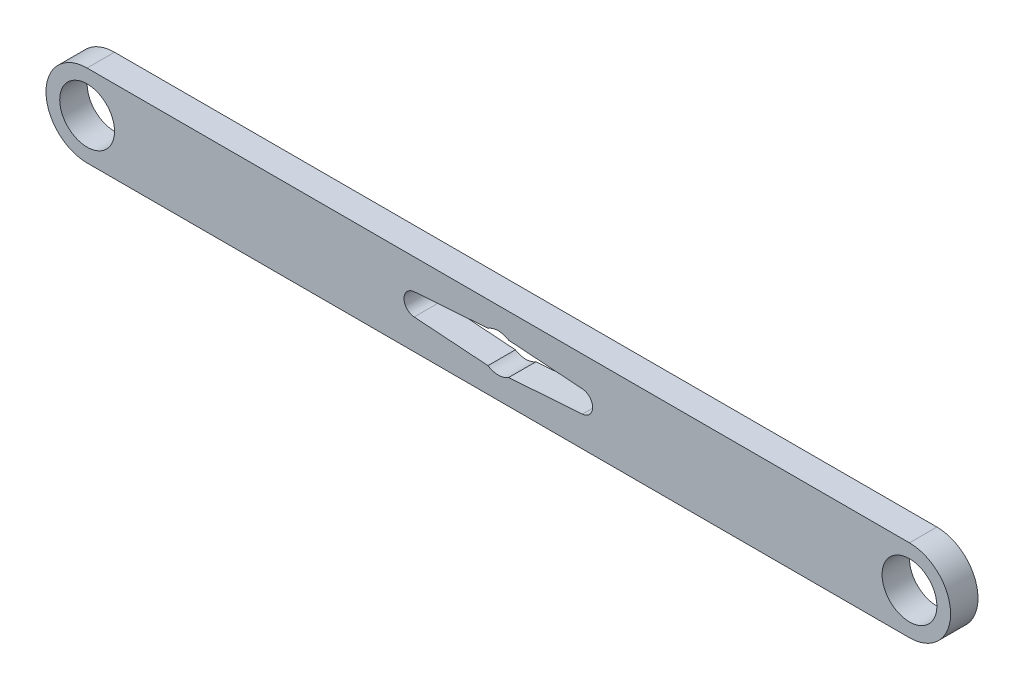
from build123d import *

# Parameters (mm, degrees)
SKETCH1_R           = 5
BOSS_EXTRUDE1_DEPTH = 5


with BuildPart() as part:
    # Sketch1 → Boss-Extrude1 (new body)
    with BuildSketch(Plane.XY):
        with BuildLine():
            Line((75, -7.5), (-75, -7.5))
            ThreePointArc((-75, -7.5), (-82.5, 0), (-75, 7.5))
            Line((-75, 7.5), (75, 7.5))
            ThreePointArc((75, 7.5), (82.5, 0), (75, -7.5))
        make_face()
        with Locations((75, 0)):
            Circle(SKETCH1_R, mode=Mode.SUBTRACT)
        with Locations((-75, 0)):
            Circle(SKETCH1_R, mode=Mode.SUBTRACT)
        with BuildLine():
            Line((-1.88348082, 2.95), (-15.34156858, 1.994983292))
            ThreePointArc((-15.34156858, 1.994983292), (-17.2, 0), (-15.34156858, -1.994983292))
            Line((-15.34156858, -1.994983292), (-1.88348082, -2.95))
            ThreePointArc((-1.88348082, -2.95), (0, -3.5), (1.88348082, -2.95))
            Line((1.88348082, -2.95), (15.34156858, -1.994983292))
            ThreePointArc((15.34156858, -1.994983292), (17.2, 0), (15.34156858, 1.994983292))
            Line((15.34156858, 1.994983292), (1.88348082, 2.95))
            ThreePointArc((1.88348082, 2.95), (0, 3.5), (-1.88348082, 2.95))
        make_face(mode=Mode.SUBTRACT)
    extrude(amount=BOSS_EXTRUDE1_DEPTH)


solid = part.part
